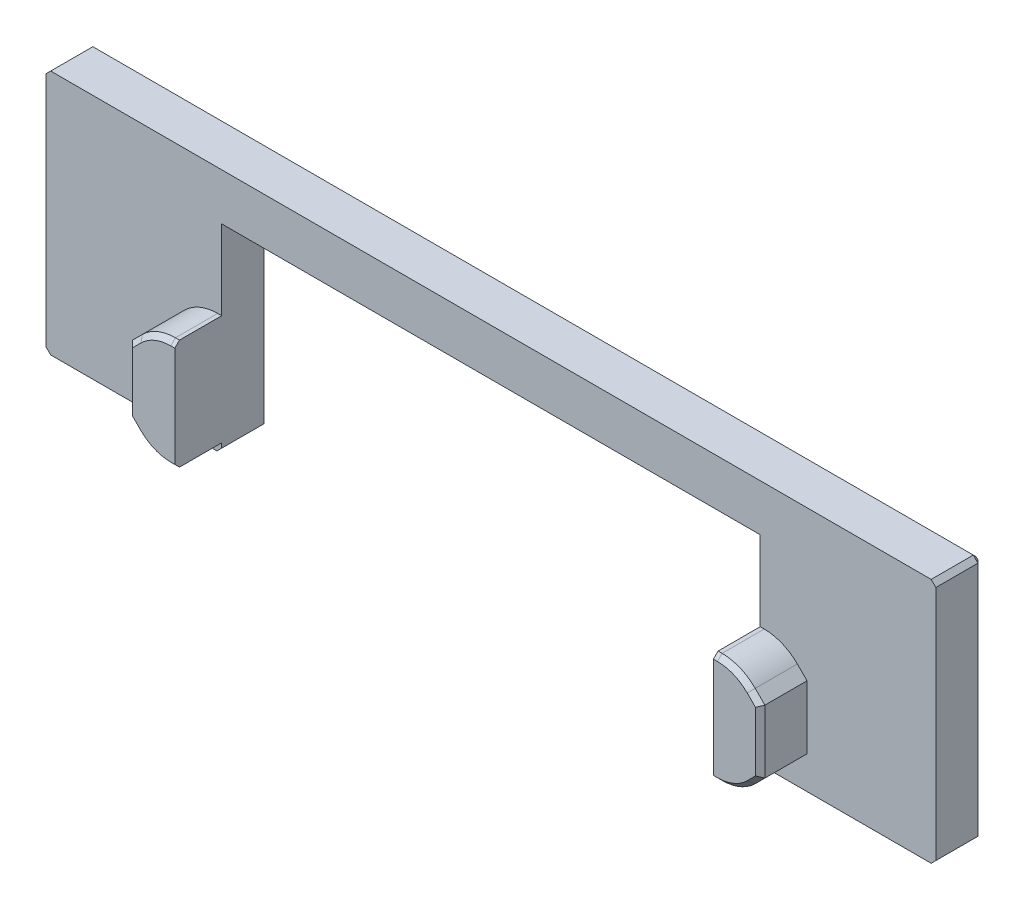
from build123d import *

# Parameters (mm, degrees)
BOSS_EXTRUDE1_DEPTH = 2
BOSS_EXTRUDE3_DEPTH = 2
DEBURS_SIZE         = 0.2


with BuildPart() as part:
    # Sketch1 → Boss-Extrude1 (new body)
    with BuildSketch(Plane.XY):
        Polygon((-18.8, 5.25), (18.8, 5.25), (19, 5.05), (19, -5.05), (18.8, -5.25), (11.7, -5.25), (11.5, -5.05), (11.5, 3.25), (-11.5, 3.25), (-11.5, -5.05), (-11.7, -5.25), (-18.8, -5.25), (-19, -5.05), (-19, 5.05), align=None)
    extrude(amount=-BOSS_EXTRUDE1_DEPTH)

    # Sketch3 → Boss-Extrude3 (add)
    with BuildSketch(Plane.XY):
        with BuildLine():
            Line((11.5, -0.15), (11.5, -4.85))
            Line((11.5, -4.85), (11.671572875, -4.85))
            ThreePointArc((11.671572875, -4.85), (12.43693974, -4.697759065), (13.085786438, -4.264213562))
            Line((13.085786438, -4.264213562), (13.5, -3.85))
            Line((13.5, -3.85), (13.5, -1.15))
            Line((13.5, -1.15), (13.085786438, -0.735786438))
            ThreePointArc((13.085786438, -0.735786438), (12.43693974, -0.302240935), (11.671572875, -0.15))
            Line((11.671572875, -0.15), (11.5, -0.15))
        make_face()
    boss_extrude3 = extrude(amount=BOSS_EXTRUDE3_DEPTH)

    # Mirror3: Boss-Extrude3 across plane
    add(boss_extrude3.mirror(Plane(origin=(0, 0, 0), x_dir=(0, 0, 1), z_dir=(1, 0, 0))))

    # Deburs
    deburs_edges = [part.edges().sort_by_distance(p)[0] for p in [
        (11.5, -0.9, -2),
        (11.6, -5.15, -2),
        (15.25, -5.25, -2),
        (18.9, -5.15, -2),
        (19, 0, -2),
        (18.9, 5.15, -2),
        (0, 5.25, -2),
        (-18.9, 5.15, -2),
        (-19, 0, -2),
        (-18.9, -5.15, -2),
        (-15.25, -5.25, -2),
        (-11.6, -5.15, -2),
        (-11.5, -0.9, -2),
        (0, 3.25, -2),
        (-11.585786438, -4.85, 2),
        (-13.292893219, -4.057106781, 2),
        (-12.43693974, -4.697759065, 2),
        (-13.5, -2.5, 2),
        (-13.292893219, -0.942893219, 2),
        (-11.585786438, -0.15, 2),
        (-12.43693974, -0.302240935, 2),
        (11.585786438, -4.85, 2),
        (13.292893219, -4.057106781, 2),
        (12.43693974, -4.697759065, 2),
        (13.5, -2.5, 2),
        (13.292893219, -0.942893219, 2),
        (11.585786438, -0.15, 2),
        (12.43693974, -0.302240935, 2),
    ]]
    chamfer(deburs_edges, length=DEBURS_SIZE)


solid = part.part
